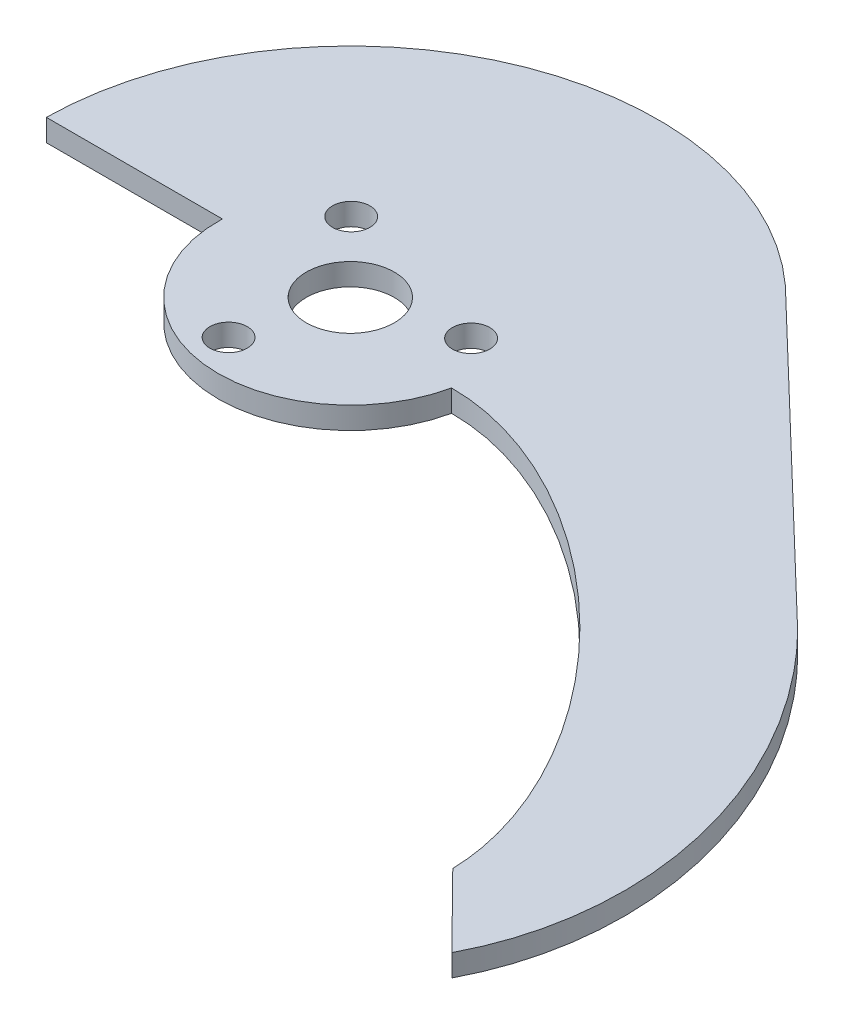
from build123d import *

# Parameters (mm, degrees)
SKETCH_1_R      = 1.7
SKETCH_1_R_2    = 4
EXTRUDE_1_DEPTH = 2


with BuildPart() as part:
    # Эскиз1 → Бобышка-Вытянуть1 (new body)
    with BuildSketch(Plane(origin=(0, 0, 0), x_dir=(1, 0, 0), z_dir=(0, 1, 0))):
        with BuildLine():
            Line((-11.994516295, 0.362737998), (-27.997650279, 0.362737998))
            ThreePointArc((-27.997650279, 0.362737998), (-19.670324553, 19.926824433), (0, 28))
            ThreePointArc((0, 28), (10.092907112, 26.117680334), (18.828808684, 20.72380186))
            Line((18.828808684, 20.72380186), (46.631425608, -5.959038999))
            add(Edge.make_bspline(
                [(56.198974962, -46.967557899), (66.951032813, -26.543612692), (46.631425608, -5.959038999)],
                knots=[3.385379592, 3.385379592, 3.385379592, 4.71238898, 4.71238898, 4.71238898], degree=2, weights=[1, 0.787838597, 1]))
            Line((56.198974962, -46.967557899), (49.614373853, -40.297093978))
            add(Edge.make_bspline(
                [(49.614373853, -40.297093978), (48.838611042, -2.3065267), (11.731761357, -2.523048843)],
                knots=[0.485518122, 0.485518122, 0.485518122, 2.687723131, 2.687723131, 2.687723131], degree=2, weights=[1, 0.452613286, 1]))
            ThreePointArc((11.731761357, -2.523048843), (-1.448862126, -11.91221216), (-11.994516295, 0.362737998))
        make_face()
        with Locations((-6.322604321, 6.40505071)):
            Circle(SKETCH_1_R, mode=Mode.SUBTRACT)
        Circle(SKETCH_1_R_2, mode=Mode.SUBTRACT)
        with Locations((8.708238788, 2.273010605)):
            Circle(SKETCH_1_R, mode=Mode.SUBTRACT)
        with Locations((-2.385634467, -8.678061315)):
            Circle(SKETCH_1_R, mode=Mode.SUBTRACT)
    extrude(amount=EXTRUDE_1_DEPTH)


solid = part.part
